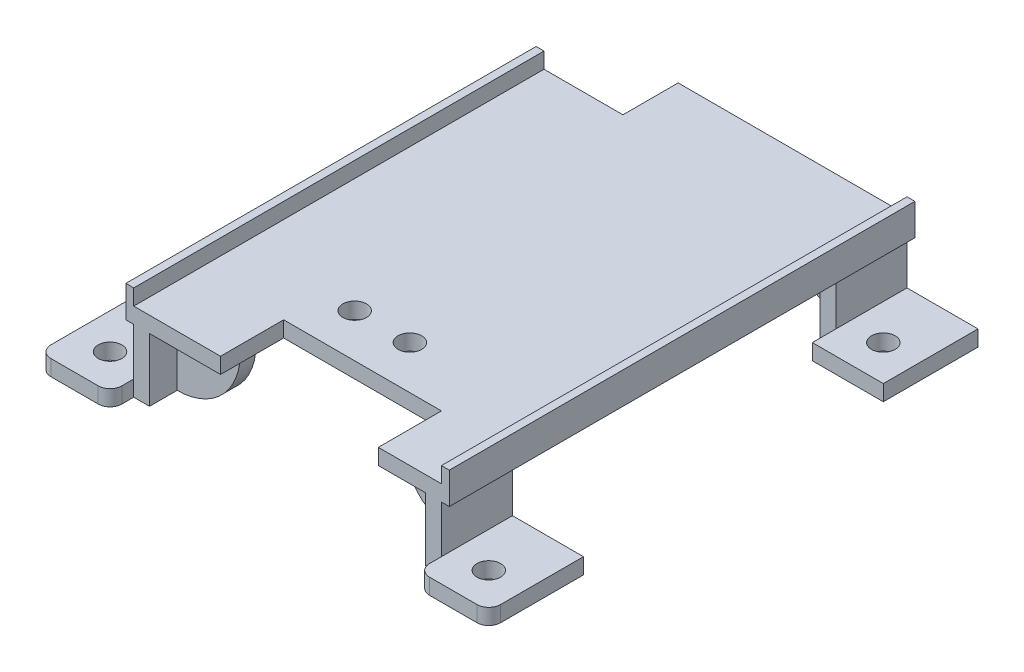
from build123d import *

# Parameters (mm, degrees)
SKETCH1_W           = 57
SKETCH1_H           = 59
BOSS_EXTRUDE1_DEPTH = 10
SKETCH2_W           = 41
SKETCH2_H           = 10
CUT_EXTRUDE1_DEPTH  = 9
SKETCH4_W           = 10
SKETCH4_H           = 7
CUT_EXTRUDE3_DEPTH  = 83.643814046
SKETCH5_W           = 34
SKETCH5_H           = 10
CUT_EXTRUDE4_DEPTH  = 9
SKETCH8_W           = 20
SKETCH8_H           = 10
CUT_EXTRUDE5_DEPTH  = 8
SKETCH9_W           = 35
SKETCH9_H           = 59
CUT_EXTRUDE6_DEPTH  = 8
SKETCH10_W          = 9
SKETCH10_H          = 7
CUT_EXTRUDE7_DEPTH  = 83.643814046
SKETCH11_W          = 9
SKETCH11_H          = 9
CUT_EXTRUDE8_DEPTH  = 8
SKETCH12_W          = 9
SKETCH12_H          = 9
CUT_EXTRUDE9_DEPTH  = 8
SKETCH13_W          = 9
SKETCH13_H          = 9
CUT_EXTRUDE10_DEPTH = 8
SKETCH14_W          = 9
SKETCH14_H          = 9
CUT_EXTRUDE11_DEPTH = 8
SKETCH15_W          = 2
SKETCH15_H          = 41
CUT_EXTRUDE12_DEPTH = 8
SKETCH16_W          = 2
SKETCH16_H          = 34
CUT_EXTRUDE13_DEPTH = 8
SKETCH31_W          = 2
SKETCH31_H          = 8
REVOLVE3_ANGLE      = 90
SKETCH32_W          = 2
SKETCH32_H          = 8
REVOLVE4_ANGLE      = 90
SKETCH33_W          = 6
SKETCH33_H          = 2
REVOLVE5_ANGLE      = 90
SKETCH34_W          = 2
SKETCH34_H          = 8
REVOLVE6_ANGLE      = 90
SKETCH42_R          = 1.5
CUT_EXTRUDE15_DEPTH = 83.643814046
SKETCH46_W          = 59
SKETCH46_H          = 2
BOSS_EXTRUDE3_DEPTH = 1
SKETCH47_W          = 1
SKETCH47_H          = 59
BOSS_EXTRUDE4_DEPTH = 2
SKETCH48_W          = 52
SKETCH48_H          = 2
BOSS_EXTRUDE5_DEPTH = 1
SKETCH49_W          = 1
SKETCH49_H          = 52
BOSS_EXTRUDE6_DEPTH = 2
SKETCH50_W          = 9
SKETCH50_H          = 2
BOSS_EXTRUDE7_DEPTH = 3
SKETCH51_W          = 9
SKETCH51_H          = 2
BOSS_EXTRUDE8_DEPTH = 3
SKETCH52_W          = 9
SKETCH52_H          = 2
BOSS_EXTRUDE9_DEPTH = 3
SKETCH53_R          = 1.5
CUT_EXTRUDE16_DEPTH = 83.643814046
FILLET2_R           = 1.5


with BuildPart() as part:
    # Sketch1 → Boss-Extrude1 (new body)
    with BuildSketch(Plane(origin=(0, 0, 0), x_dir=(1, 0, 0), z_dir=(0, 1, 0))):
        with Locations((28.5, 29.5)):
            Rectangle(SKETCH1_W, SKETCH1_H)
    extrude(amount=BOSS_EXTRUDE1_DEPTH)

    # Sketch2 → Cut-Extrude1 (cut)
    with BuildSketch(Plane(origin=(57, 0, 0), x_dir=(0, 0, -1), z_dir=(1, 0, 0))):
        with Locations((29.5, 5)):
            Rectangle(SKETCH2_W, SKETCH2_H)
    extrude(amount=-CUT_EXTRUDE1_DEPTH, mode=Mode.SUBTRACT)

    # Sketch4 → Cut-Extrude3 (cut, through all)
    with BuildSketch(Plane(origin=(0, 10, 0), x_dir=(1, 0, 0), z_dir=(0, 1, 0))):
        with Locations((5, 55.5)):
            Rectangle(SKETCH4_W, SKETCH4_H)
    extrude(amount=-CUT_EXTRUDE3_DEPTH, mode=Mode.SUBTRACT)

    # Sketch5 → Cut-Extrude4 (cut)
    with BuildSketch(Plane.ZY):
        with Locations((-26, 5)):
            Rectangle(SKETCH5_W, SKETCH5_H)
    extrude(amount=-CUT_EXTRUDE4_DEPTH, mode=Mode.SUBTRACT)

    # Sketch8 → Cut-Extrude5 (cut)
    with BuildSketch(Plane.XY):
        with Locations((30, 5)):
            Rectangle(SKETCH8_W, SKETCH8_H)
    extrude(amount=-CUT_EXTRUDE5_DEPTH, mode=Mode.SUBTRACT)

    # Sketch9 → Cut-Extrude6 (cut)
    with BuildSketch(Plane(origin=(0, 0, 0), x_dir=(-1, 0, 0), z_dir=(0, -1, 0))):
        with Locations((-28.5, 29.5)):
            Rectangle(SKETCH9_W, SKETCH9_H)
    extrude(amount=-CUT_EXTRUDE6_DEPTH, mode=Mode.SUBTRACT)

    # Sketch10 → Cut-Extrude7 (cut, through all)
    with BuildSketch(Plane(origin=(0, 10, 0), x_dir=(1, 0, 0), z_dir=(0, 1, 0))):
        with Locations((14.5, 55.5)):
            Rectangle(SKETCH10_W, SKETCH10_H)
    extrude(amount=-CUT_EXTRUDE7_DEPTH, mode=Mode.SUBTRACT)

    # Sketch11 → Cut-Extrude8 (cut)
    with BuildSketch(Plane(origin=(0, 10, 0), x_dir=(1, 0, 0), z_dir=(0, 1, 0))):
        with Locations((52.5, 4.5)):
            Rectangle(SKETCH11_W, SKETCH11_H)
    extrude(amount=-CUT_EXTRUDE8_DEPTH, mode=Mode.SUBTRACT)

    # Sketch12 → Cut-Extrude9 (cut)
    with BuildSketch(Plane(origin=(0, 10, 0), x_dir=(1, 0, 0), z_dir=(0, 1, 0))):
        with Locations((52.5, 54.5)):
            Rectangle(SKETCH12_W, SKETCH12_H)
    extrude(amount=-CUT_EXTRUDE9_DEPTH, mode=Mode.SUBTRACT)

    # Sketch13 → Cut-Extrude10 (cut)
    with BuildSketch(Plane(origin=(0, 10, 0), x_dir=(1, 0, 0), z_dir=(0, 1, 0))):
        with Locations((4.5, 47.5)):
            Rectangle(SKETCH13_W, SKETCH13_H)
    extrude(amount=-CUT_EXTRUDE10_DEPTH, mode=Mode.SUBTRACT)

    # Sketch14 → Cut-Extrude11 (cut)
    with BuildSketch(Plane(origin=(0, 10, 0), x_dir=(1, 0, 0), z_dir=(0, 1, 0))):
        with Locations((4.5, 4.5)):
            Rectangle(SKETCH14_W, SKETCH14_H)
    extrude(amount=-CUT_EXTRUDE11_DEPTH, mode=Mode.SUBTRACT)

    # Sketch15 → Cut-Extrude12 (cut)
    with BuildSketch(Plane(origin=(0, 0, 0), x_dir=(-1, 0, 0), z_dir=(0, -1, 0))):
        with Locations((-47, 29.5)):
            Rectangle(SKETCH15_W, SKETCH15_H)
    extrude(amount=-CUT_EXTRUDE12_DEPTH, mode=Mode.SUBTRACT)

    # Sketch16 → Cut-Extrude13 (cut)
    with BuildSketch(Plane(origin=(0, 0, 0), x_dir=(-1, 0, 0), z_dir=(0, -1, 0))):
        with Locations((-10, 26)):
            Rectangle(SKETCH16_W, SKETCH16_H)
    extrude(amount=-CUT_EXTRUDE13_DEPTH, mode=Mode.SUBTRACT)

    # Sketch31 → Revolve3 (revolve)
    with BuildSketch(Plane(origin=(11, 0, 0), x_dir=(0, 0, -1), z_dir=(1, 0, 0))):
        with Locations((4.5, 4)):
            Rectangle(SKETCH31_W, SKETCH31_H)
    revolve(axis=Axis((11, 8, -3.5), (0, 0, 1)), revolution_arc=REVOLVE3_ANGLE)

    # Sketch32 → Revolve4 (revolve)
    with BuildSketch(Plane(origin=(11, 0, 0), x_dir=(0, 0, -1), z_dir=(1, 0, 0))):
        with Locations((47.5, 4)):
            Rectangle(SKETCH32_W, SKETCH32_H)
    revolve(axis=Axis((11, 8, -46.5), (0, 0, 1)), revolution_arc=REVOLVE4_ANGLE)

    # Sketch33 → Revolve5 (revolve)
    with BuildSketch(Plane.XZ.offset(-8)):
        with Locations((43, -4.5)):
            Rectangle(SKETCH33_W, SKETCH33_H)
    revolve(axis=Axis((46, 8, -3.5), (0, 0, 1)), revolution_arc=REVOLVE5_ANGLE)

    # Sketch34 → Revolve6 (revolve)
    with BuildSketch(Plane.ZY.offset(-46)):
        with Locations((-54.5, 4)):
            Rectangle(SKETCH34_W, SKETCH34_H)
    revolve(axis=Axis((46, 8, -53.5), (0, 0, -1)), revolution_arc=REVOLVE6_ANGLE)

    # Sketch42 → Cut-Extrude15 (cut, through all)
    with BuildSketch(Plane(origin=(0, 10, 0), x_dir=(1, 0, 0), z_dir=(0, 1, 0))):
        with Locations((23.5, 13.5)):
            Circle(SKETCH42_R)
        with Locations((30.5, 13.5)):
            Circle(SKETCH42_R)
    extrude(amount=-CUT_EXTRUDE15_DEPTH, mode=Mode.SUBTRACT)

    # Sketch46 → Boss-Extrude3 (add)
    with BuildSketch(Plane(origin=(48, 0, 0), x_dir=(0, 0, -1), z_dir=(1, 0, 0))):
        with Locations((29.5, 9)):
            Rectangle(SKETCH46_W, SKETCH46_H)
    extrude(amount=BOSS_EXTRUDE3_DEPTH)

    # Sketch47 → Boss-Extrude4 (add)
    with BuildSketch(Plane(origin=(0, 10, 0), x_dir=(1, 0, 0), z_dir=(0, 1, 0))):
        with Locations((48.5, 29.5)):
            Rectangle(SKETCH47_W, SKETCH47_H)
    extrude(amount=BOSS_EXTRUDE4_DEPTH)

    # Sketch48 → Boss-Extrude5 (add)
    with BuildSketch(Plane.ZY.offset(-9)):
        with Locations((-26, 9)):
            Rectangle(SKETCH48_W, SKETCH48_H)
    extrude(amount=BOSS_EXTRUDE5_DEPTH)

    # Sketch49 → Boss-Extrude6 (add)
    with BuildSketch(Plane(origin=(0, 10, 0), x_dir=(1, 0, 0), z_dir=(0, 1, 0))):
        with Locations((8.5, 26)):
            Rectangle(SKETCH49_W, SKETCH49_H)
    extrude(amount=BOSS_EXTRUDE6_DEPTH)

    # Sketch50 → Boss-Extrude7 (add)
    with BuildSketch(Plane.XY):
        with Locations((4.5, 1)):
            Rectangle(SKETCH50_W, SKETCH50_H)
        with Locations((52.5, 1)):
            Rectangle(SKETCH50_W, SKETCH50_H)
    extrude(amount=BOSS_EXTRUDE7_DEPTH)

    # Sketch51 → Boss-Extrude8 (add)
    with BuildSketch(Plane.XY.offset(-43)):
        with Locations((4.5, 1)):
            Rectangle(SKETCH51_W, SKETCH51_H)
    extrude(amount=BOSS_EXTRUDE8_DEPTH)

    # Sketch52 → Boss-Extrude9 (add)
    with BuildSketch(Plane.XY.offset(-50)):
        with Locations((52.5, 1)):
            Rectangle(SKETCH52_W, SKETCH52_H)
    extrude(amount=BOSS_EXTRUDE9_DEPTH)

    # Sketch53 → Cut-Extrude16 (cut, through all)
    with BuildSketch(Plane(origin=(0, 2, 0), x_dir=(1, 0, 0), z_dir=(0, 1, 0))):
        with Locations((4.5, 44.5)):
            Circle(SKETCH53_R)
        with Locations((52.5, 51.5)):
            Circle(SKETCH53_R)
        with Locations((52.5, 1.5)):
            Circle(SKETCH53_R)
        with Locations((4.5, 1.5)):
            Circle(SKETCH53_R)
    extrude(amount=-CUT_EXTRUDE16_DEPTH, mode=Mode.SUBTRACT)

    # Fillet2
    fillet2_edges = [part.edges().sort_by_distance(p)[0] for p in [
        (57, 1, 3),
        (48, 1, 3),
        (9, 1, 3),
        (0, 1, 3),
    ]]
    fillet(fillet2_edges, radius=FILLET2_R)


solid = part.part
